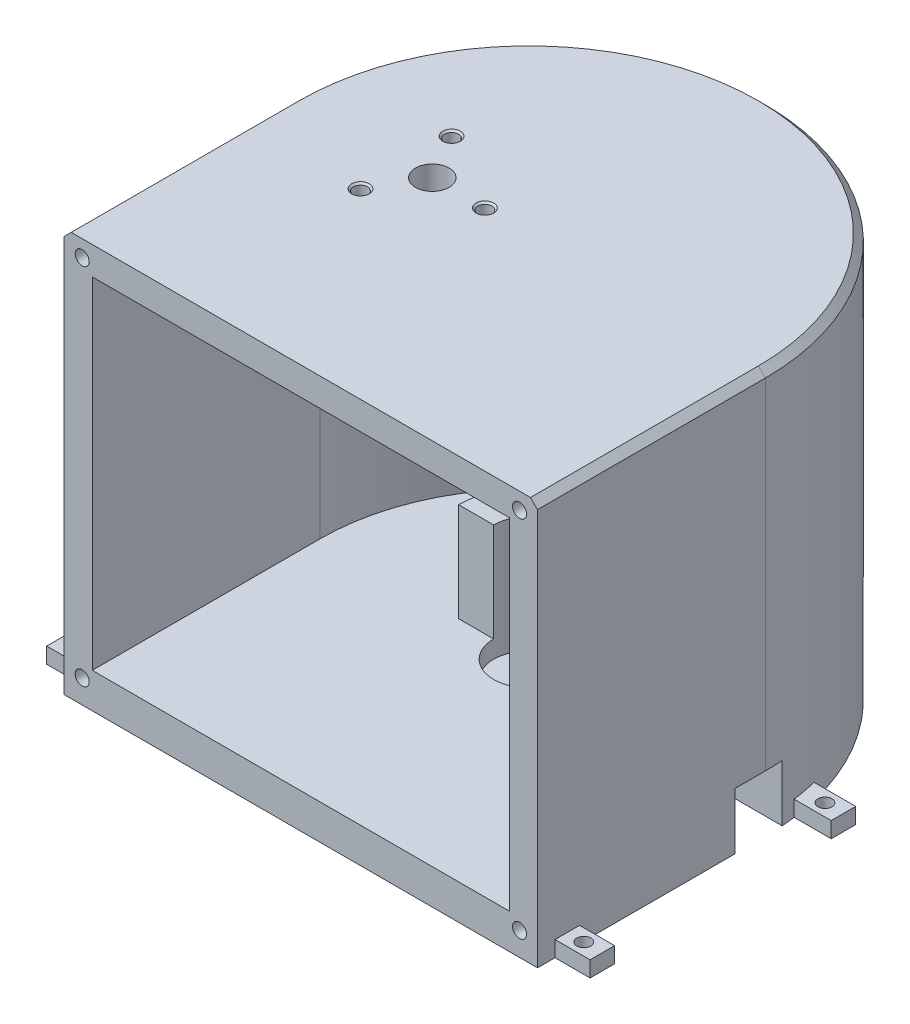
from build123d import *

# Parameters (mm, degrees)
BOSS_EXTRUDE3_DEPTH                   = 65
BOSS_EXTRUDE1_DEPTH                   = 6
BOSS_EXTRUDE1_DEPTH_BACK              = 6.25
SKETCH1_5_W                           = 6.6044296
SKETCH1_5_H                           = 19
SKETCH1_5_W_2                         = 10.945657065
BOSS_EXTRUDE2_START                   = -8.75
BOSS_EXTRUDE2_OUTLINE_W               = 40.850086665
BOSS_EXTRUDE2_OUTLINE_H               = 19
BOSS_EXTRUDE2_DEPTH                   = 2.5
REVOLVE2_ANGLE                        = 180
SKETCH1_12_W                          = 10
SKETCH1_12_H                          = 5
REVOLVE4_START                        = -10
REVOLVE4_DEPTH                        = 28.178366994
SERVO_START                           = 67.5
SKETCH9_W                             = 13.671614749
SKETCH9_H                             = 17.273170498
SERVO_WIRE_CUT_DEPTH                  = 18.945657065
CUT_EXTRUDE2_DEPTH                    = 3.5
F_4_0_4_DIAMETER_HOLE1_D              = 4
F_4_0_4_DIAMETER_HOLE1_DEPTH          = 8
F_4_0_4_DIAMETER_HOLE1_CSINK_D        = 5
F_4_0_4_DIAMETER_HOLE1_CSINK_ANGLE    = 90
CIRPATTERN1_COUNT                     = 3
CUT_EXTRUDE4_REACH                    = 151.61
SKETCH21_2_R                          = 4.8
SKETCH12_R                            = 2
HEAT_SET_INSERT_CUT_DEPTH             = 17
HEAT_SET_INSERT_CUT_DIRECTION_2_REACH = 136.816
SKETCH14_R                            = 2
PANEL_HEAT_SET_INSERT_CUT_DEPTH       = 10
BOSS_EXTRUDE10_START                  = -5
SKETCH16_W                            = 7
SKETCH16_H                            = 4.5
BOSS_EXTRUDE10_DEPTH                  = 15
SKETCH18_W                            = 7
SKETCH18_H                            = 3.5
BOSS_EXTRUDE11_DEPTH                  = 10
SKETCH19_R                            = 2
CUT_EXTRUDE1_DEPTH                    = 152.05205452
CHAMFER1_SIZE                         = 2


# Read off the part's stored shape, not the designer's step: Boss-Extrude2, Revolve4
with BuildPart() as part:
    # Sketch4 → Boss-Extrude3 (new body)
    with BuildSketch(Plane.XY):
        Polygon((59.5, -10), (0, -10), (0, -15), (0, -20), (67.5, -20), (67.5, 95.198794821), (0, 95.198794821), (0, 87.198794821), (59.5, 87.198794821), align=None)
    boss_extrude3 = extrude(amount=BOSS_EXTRUDE3_DEPTH)

    # Mirror1: Boss-Extrude3 across plane
    add(boss_extrude3.mirror(Plane(origin=(0, 0, 0), x_dir=(0, 0, 1), z_dir=(1, 0, 0))))

    # Sketch1<5> → Boss-Extrude1 (add, two sides: drawn at the far end of the back side and taken through both)
    with BuildSketch(Plane.XY.offset(-BOSS_EXTRUDE1_DEPTH_BACK)):
        with Locations((21.952128135, -0.5)):
            Rectangle(SKETCH1_5_W, SKETCH1_5_H)
        with Locations((54.027171468, -0.5)):
            Rectangle(SKETCH1_5_W_2, SKETCH1_5_H)
    extrude(amount=BOSS_EXTRUDE1_DEPTH + BOSS_EXTRUDE1_DEPTH_BACK)

    # Boss-Extrude2 outline → Boss-Extrude2 (add)
    with BuildSketch(Plane.XY.offset(BOSS_EXTRUDE2_START)):
        with Locations((39.074956668, -0.5)):
            Rectangle(BOSS_EXTRUDE2_OUTLINE_W, BOSS_EXTRUDE2_OUTLINE_H)
    extrude(amount=BOSS_EXTRUDE2_DEPTH)

    # Sketch1 → Revolve2 (revolve)
    with BuildSketch(Plane.XY):
        Polygon((0, -15), (0, -20), (67.5, -20), (67.5, 95.198794821), (0, 95.198794821), (0, 87.198794821), (59.5, 87.198794821), (59.5, -10), (0, -10), align=None)
    revolve(axis=Axis((0, -1000, 0), (0, 1, 0)), revolution_arc=REVOLVE2_ANGLE)

    # Sketch1<12> → Cut-Revolve4 (revolve, cut)
    with BuildSketch(Plane.XY):
        with Locations((5, -12.5)):
            Rectangle(SKETCH1_12_W, SKETCH1_12_H)
    revolve(axis=Axis((0, -1000, 0), (0, 1, 0)), mode=Mode.SUBTRACT)

    # Revolve4 outline → Revolve4 (add)
    with BuildSketch(Plane(origin=(0, 0, 0), x_dir=(1, 0, 0), z_dir=(0, 1, 0)).offset(REVOLVE4_START)):
        with BuildLine():
            ThreePointArc((-10, 0), (0, 10), (10, 0))
            Line((10, 0), (20, 0))
            ThreePointArc((20, 0), (0, 20), (-20, 0))
            Line((-20, 0), (-10, 0))
        make_face()
    extrude(amount=REVOLVE4_DEPTH)

    # Sketch9 → Servo Wire Cut (cut)
    with BuildSketch(Plane(origin=(0, 0, 0), x_dir=(0, 0, -1), z_dir=(1, 0, 0)).offset(SERVO_START)):
        with Locations((-1.860269854, -12.475825554)):
            Rectangle(SKETCH9_W, SKETCH9_H)
    extrude(amount=-SERVO_WIRE_CUT_DEPTH, mode=Mode.SUBTRACT)

    # Sketch1<13> → Cut-Extrude2 (cut, symmetric)
    with BuildSketch(Plane.XY):
        Polygon((22.754342935, -12.920336749), (59.5, -12.920336749), (59.5, -10), (25.254342935, -10), (25.254342935, 9), (22.754342935, 9), align=None)
    extrude(amount=CUT_EXTRUDE2_DEPTH, both=True, mode=Mode.SUBTRACT)

    # Ø4.0 (4) Diameter Hole1
    with Locations(Plane(origin=(0, 95.198794821, 0), x_dir=(1, 0, 0), z_dir=(0, 1, 0))):
        with Locations((-12.5, 0)):
            f_4_0_4_diameter_hole1 = CounterSinkHole(F_4_0_4_DIAMETER_HOLE1_D / 2, F_4_0_4_DIAMETER_HOLE1_CSINK_D / 2, depth=F_4_0_4_DIAMETER_HOLE1_DEPTH, counter_sink_angle=F_4_0_4_DIAMETER_HOLE1_CSINK_ANGLE)

    # CirPattern1: Ø4.0 (4) Diameter Hole1 ×3 about axis
    cirpattern1_axis = Axis((-27.5, 0, 0), (0, 1, 0))
    for i in range(1, CIRPATTERN1_COUNT):
        add(f_4_0_4_diameter_hole1.rotate(cirpattern1_axis, i * 360 / CIRPATTERN1_COUNT), mode=Mode.SUBTRACT)

    # Sketch21<2> → Cut-Extrude4 (cut, up to next)
    with BuildSketch(Plane(origin=(0, 95.198794821, 0), x_dir=(1, 0, 0), z_dir=(0, 1, 0)), mode=Mode.PRIVATE) as cut_extrude4_sk1:
        with Locations(Location((-27.5, 0, 0), (0, 0, 270))):
            Circle(SKETCH21_2_R)
    cut_extrude4_tool1 = extrude(cut_extrude4_sk1.sketch, amount=-CUT_EXTRUDE4_REACH, mode=Mode.PRIVATE) & part.part
    add(cut_extrude4_tool1.solids().sort_by_distance((-27.5, 95.198795, 0))[0], mode=Mode.SUBTRACT)

    # Sketch12 → Heat Set Insert Cut (cut)
    with BuildSketch(Plane.XY):
        with Locations(Location((54.027171468, 2.884785525, 0), (0, 0, 180))):
            Circle(SKETCH12_R)
        with Locations(Location((15, 2.884785525, 0), (0, 0, 180))):
            Circle(SKETCH12_R)
    extrude(amount=-HEAT_SET_INSERT_CUT_DEPTH, mode=Mode.SUBTRACT)

    # Heat Set Insert Cut direction 2: up to this face of the body (flat: up to its plane)
    heat_set_insert_cut_direction_2_end = Plane(part.part.faces().sort_by_distance((54.027171468, 2.580379847, 6))[0])
    # Sketch12 → Heat Set Insert Cut direction 2 (cut, up to the picked face)
    with BuildSketch(Plane.XY, mode=Mode.PRIVATE) as heat_set_insert_cut_direction_2_sk1:
        with Locations(Location((54.027171468, 2.884785525, 0), (0, 0, 180))):
            Circle(SKETCH12_R)
    heat_set_insert_cut_direction_2_tool1 = split(extrude(heat_set_insert_cut_direction_2_sk1.sketch, amount=HEAT_SET_INSERT_CUT_DIRECTION_2_REACH, mode=Mode.PRIVATE), bisect_by=heat_set_insert_cut_direction_2_end, keep=Keep.BOTH, mode=Mode.PRIVATE)
    # Sketch12 → Heat Set Insert Cut direction 2 (cut, up to the picked face)
    with BuildSketch(Plane.XY, mode=Mode.PRIVATE) as heat_set_insert_cut_direction_2_sk2:
        with Locations(Location((15, 2.884785525, 0), (0, 0, 180))):
            Circle(SKETCH12_R)
    heat_set_insert_cut_direction_2_tool2 = split(extrude(heat_set_insert_cut_direction_2_sk2.sketch, amount=HEAT_SET_INSERT_CUT_DIRECTION_2_REACH, mode=Mode.PRIVATE), bisect_by=heat_set_insert_cut_direction_2_end, keep=Keep.BOTH, mode=Mode.PRIVATE)
    add(heat_set_insert_cut_direction_2_tool1.solids().sort_by(Axis((54.027171, 2.884786, 0), (0, 0, 1)))[0], mode=Mode.SUBTRACT)
    add(heat_set_insert_cut_direction_2_tool2.solids().sort_by(Axis((15, 2.884786, 0), (0, 0, 1)))[0], mode=Mode.SUBTRACT)

    # Sketch14 → Panel Heat Set Insert Cut (cut)
    with BuildSketch(Plane.XY.offset(65)):
        with Locations((-62.379754231, 90.491593885)):
            Circle(SKETCH14_R)
        with Locations((62.379754231, 90.491593885)):
            Circle(SKETCH14_R)
        with Locations((62.379754231, -13.292799065)):
            Circle(SKETCH14_R)
        with Locations((-62.379754231, -13.292799065)):
            Circle(SKETCH14_R)
    extrude(amount=-PANEL_HEAT_SET_INSERT_CUT_DEPTH, mode=Mode.SUBTRACT)

    # Sketch16 → Boss-Extrude10 (add)
    with BuildSketch(Plane.ZY.offset(67.5).offset(BOSS_EXTRUDE10_START)):
        with Locations((-12.283009655, -17.75)):
            Rectangle(SKETCH16_W, SKETCH16_H)
        with Locations((56.5, -17.75)):
            Rectangle(SKETCH16_W, SKETCH16_H)
    boss_extrude10 = extrude(amount=BOSS_EXTRUDE10_DEPTH)

    # Sketch18 → Boss-Extrude11 (add)
    with BuildSketch(Plane(origin=(67.5, 0, 0), x_dir=(0, 0, -1), z_dir=(1, 0, 0))):
        with Locations((-56.5, -18.25)):
            Rectangle(SKETCH18_W, SKETCH18_H)
    extrude(amount=BOSS_EXTRUDE11_DEPTH)

    # Sketch19 → Cut-Extrude1 (cut, through all)
    with BuildSketch(Plane(origin=(0, -15.5, 0), x_dir=(1, 0, 0), z_dir=(0, 1, 0))):
        with Locations(Location((-72.213071965, -56.5, 0), (0, 0, 180))):
            Circle(SKETCH19_R)
        with Locations(Location((-72.213071965, 12.283009655, 0), (0, 0, 180))):
            Circle(SKETCH19_R)
        with Locations(Location((72.5, -56.5, 0), (0, 0, 180))):
            Circle(SKETCH19_R)
    cut_extrude1 = extrude(amount=-CUT_EXTRUDE1_DEPTH, mode=Mode.SUBTRACT)

    # Mirror3: Boss-Extrude10, Cut-Extrude1 across plane
    add(boss_extrude10.mirror(Plane(origin=(0, 0, 0), x_dir=(0, 0, 1), z_dir=(1, 0, 0))))
    add(cut_extrude1.mirror(Plane(origin=(0, 0, 0), x_dir=(0, 0, 1), z_dir=(1, 0, 0))), mode=Mode.SUBTRACT)

    # Chamfer1
    chamfer1_edges = [part.edges().sort_by_distance(p)[0] for p in [
        (0, 95.198794821, -67.5),
        (67.5, 95.198794821, 32.5),
        (-67.5, 95.198794821, 32.5),
    ]]
    chamfer(chamfer1_edges, length=CHAMFER1_SIZE)


solid = part.part
